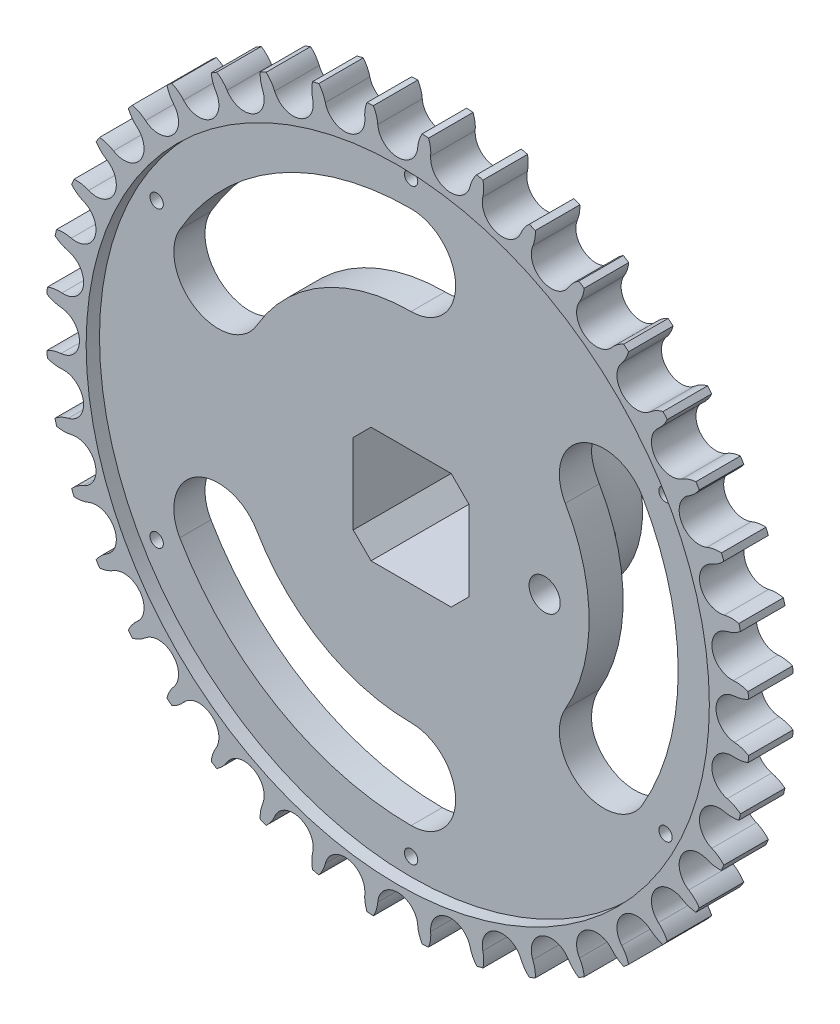
from build123d import *

# Parameters (mm, degrees)
SKETCH1_R               = 39.5
BOSS_EXTRUDE1_DEPTH     = 5
CUT_EXTRUDE1_DEPTH      = 5
SKETCH3_R               = 12.5
BOSS_EXTRUDE2_DEPTH     = 10
FILLET1_R               = 10
CUT_EXTRUDE2_DEPTH      = 10
SKETCH5_R               = 35
CUT_EXTRUDE3_DEPTH      = 1.5
CUT_EXTRUDE4_START      = -5
SKETCH7_R               = 2.25
CUT_EXTRUDE4_DEPTH      = 5
CIRPATTERN1_COUNT       = 40
CUT_EXTRUDE5_DEPTH      = 57.617141551
CUT_EXTRUDE5_DEPTH_BACK = 57.617141551
SKETCH8_R               = 0.75
SKETCH8_R_2             = 1.75


with BuildPart() as part:
    # Sketch1 → Boss-Extrude1 (new body)
    with BuildSketch(Plane.XY):
        Circle(SKETCH1_R)
    extrude(amount=BOSS_EXTRUDE1_DEPTH)

    # Sketch2 → Cut-Extrude1 (cut)
    with BuildSketch(Plane.XY.offset(5)):
        Polygon((4.5, 6.5), (6.5, 4.5), (6.5, -4.5), (4.5, -6.5), (-4.5, -6.5), (-6.5, -4.5), (-6.5, 4.5), (-4.5, 6.5), align=None)
    extrude(amount=-CUT_EXTRUDE1_DEPTH, mode=Mode.SUBTRACT)

    # Sketch3 → Boss-Extrude2 (add)
    with BuildSketch(Plane(origin=(0, 0, 0), x_dir=(-1, 0, 0), z_dir=(0, 0, -1))):
        with Locations(Location((0, 0, 0), (0, 0, 180))):
            Circle(SKETCH3_R)
        Polygon((6.5, -4.5), (4.5, -6.5), (-4.5, -6.5), (-6.5, -4.5), (-6.5, 4.5), (-4.5, 6.5), (4.5, 6.5), (6.5, 4.5), align=None, mode=Mode.SUBTRACT)
    extrude(amount=BOSS_EXTRUDE2_DEPTH)

    # Fillet1
    fillet1_edges = [part.edges().sort_by_distance(p)[0] for p in [
        (-12.5, 0, 0),
    ]]
    fillet(fillet1_edges, radius=FILLET1_R - 0.0001)  # a hair under: the kernel refuses the full size

    # Sketch4 → Cut-Extrude2 (cut)
    with BuildSketch(Plane.XY.offset(5)):
        with BuildLine():
            ThreePointArc((0, 30), (-15, 25.980762114), (-25.980762114, 15))
            ThreePointArc((-25.980762114, 15), (-24.150635095, 8.169872981), (-17.320508076, 10))
            ThreePointArc((-17.320508076, 10), (-10, 17.320508076), (0, 20))
            ThreePointArc((0, 20), (5, 25), (0, 30))
        make_face()
        with BuildLine():
            ThreePointArc((17.320508076, -10), (20, 0), (17.320508076, 10))
            ThreePointArc((17.320508076, 10), (19.150635095, 16.830127019), (25.980762114, 15))
            ThreePointArc((25.980762114, 15), (30, 0), (25.980762114, -15))
            ThreePointArc((25.980762114, -15), (19.150635095, -16.830127019), (17.320508076, -10))
        make_face()
        with BuildLine():
            ThreePointArc((-17.320508076, -10), (-10, -17.320508076), (0, -20))
            ThreePointArc((0, -20), (5, -25), (0, -30))
            ThreePointArc((0, -30), (-15, -25.980762114), (-25.980762114, -15))
            ThreePointArc((-25.980762114, -15), (-24.150635095, -8.169872981), (-17.320508076, -10))
        make_face()
    extrude(amount=-CUT_EXTRUDE2_DEPTH, mode=Mode.SUBTRACT)

    # Sketch5 → Cut-Extrude3 (cut)
    with BuildSketch(Plane.XY.offset(5)):
        Circle(SKETCH5_R)
    extrude(amount=-CUT_EXTRUDE3_DEPTH, mode=Mode.SUBTRACT)

    # Sketch7 → Cut-Extrude4 (cut)
    with BuildSketch(Plane.XY.offset(5).offset(CUT_EXTRUDE4_START)):
        with Locations((0, 38)):
            Circle(SKETCH7_R)
        with BuildLine():
            ThreePointArc((2.25, 38), (2.248265332, 37.911665415), (2.243064001, 37.823467035))
            ThreePointArc((2.243064001, 37.823467035), (2.401439488, 38.642208878), (2.738547296, 39.404953479))
            ThreePointArc((2.738547296, 39.404953479), (2.224177876, 39.437330447), (1.709429803, 39.462993421))
            ThreePointArc((1.709429803, 39.462993421), (2.110535128, 38.779834259), (2.25, 38))
        make_face()
        with BuildLine():
            ThreePointArc((-2.738547296, 39.404953479), (-2.401439488, 38.642208878), (-2.243064001, 37.823467035))
            ThreePointArc((-2.243064001, 37.823467035), (-2.139524132, 38.696373815), (-1.709429803, 39.462993421))
            ThreePointArc((-1.709429803, 39.462993421), (-2.224177876, 39.437330447), (-2.738547296, 39.404953479))
        make_face()
    cut_extrude4 = extrude(amount=CUT_EXTRUDE4_DEPTH, mode=Mode.SUBTRACT)

    # CirPattern1: Cut-Extrude4 ×40 about axis
    cirpattern1_axis = Axis((0, 0, 0), (0, 0, 1))
    for i in range(1, CIRPATTERN1_COUNT):
        add(cut_extrude4.rotate(cirpattern1_axis, i * 360 / CIRPATTERN1_COUNT), mode=Mode.SUBTRACT)

    # Sketch8 → Cut-Extrude5 (cut, two sides: drawn at the far end of the back side and taken through both)
    with BuildSketch(Plane.XY.offset(-CUT_EXTRUDE5_DEPTH_BACK)):
        with Locations((0, 33)):
            Circle(SKETCH8_R)
        with Locations(Location((15, 0, 0), (0, 0, 185.370049123))):
            Circle(SKETCH8_R_2)
        with Locations((28.578838325, 16.5)):
            Circle(SKETCH8_R)
        with Locations((28.578838325, -16.5)):
            Circle(SKETCH8_R)
        with Locations((0, -33)):
            Circle(SKETCH8_R)
        with Locations((-28.578838325, -16.5)):
            Circle(SKETCH8_R)
        with Locations((-28.578838325, 16.5)):
            Circle(SKETCH8_R)
    extrude(amount=CUT_EXTRUDE5_DEPTH + CUT_EXTRUDE5_DEPTH_BACK, mode=Mode.SUBTRACT)


solid = part.part
